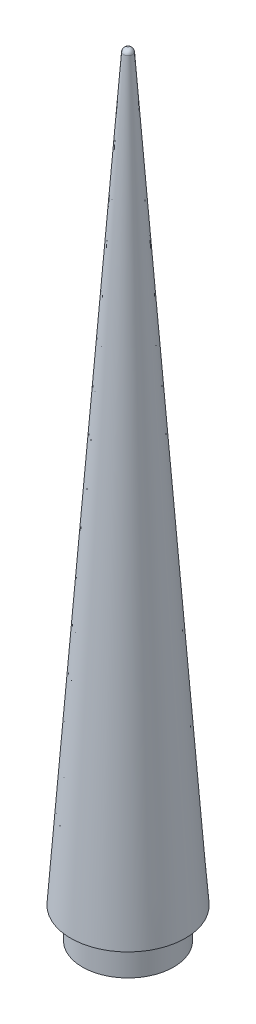
from build123d import *

# Parameters (mm, degrees)
SKETCH1_R           = 9.398
BOSS_EXTRUDE1_DEPTH = 6.35
FILLET1_R           = 0.889


with BuildPart() as part:
    # Sketch1 → Boss-Extrude1 (new body)
    with BuildSketch(Plane(origin=(0, 0, 0), x_dir=(1, 0, 0), z_dir=(0, 1, 0))):
        Circle(SKETCH1_R)
    extrude(amount=BOSS_EXTRUDE1_DEPTH)

    # Sketch2 → Revolve1 (revolve)
    with BuildSketch(Plane.XY):
        Polygon((11.811, 6.35), (0.889, 159.258), (0, 159.258), (0, 6.35), align=None)
    revolve(axis=Axis((0, 159.258, 0), (0, -1, 0)))

    # Fillet1
    fillet1_edges = [part.edges().sort_by_distance(p)[0] for p in [
        (-0.889, 159.258, 0),
    ]]
    fillet(fillet1_edges, radius=FILLET1_R)


solid = part.part
